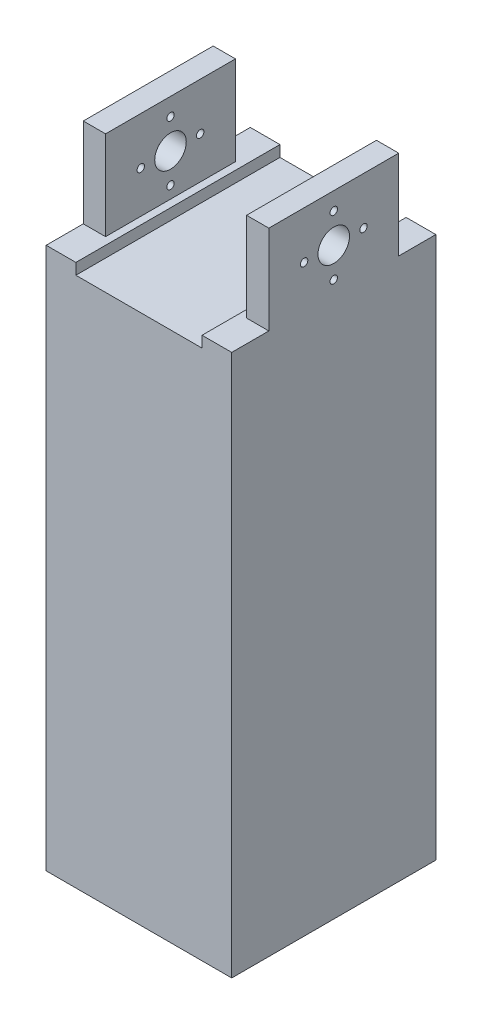
from build123d import *

# Parameters (mm, degrees)
SKETCH1_W           = 50
SKETCH1_H           = 170
BOSS_EXTRUDE1_DEPTH = 55
SKETCH2_W           = 34
SKETCH2_H           = 27
CUT_EXTRUDE1_DEPTH  = 181.416185527
SKETCH3_W           = 10
SKETCH3_H           = 24
SKETCH3_R           = 4.25
SKETCH3_R_2         = 1
CUT_EXTRUDE2_DEPTH  = 186.539753153
SKETCH4_W           = 2
SKETCH4_H           = 24
CUT_EXTRUDE3_DEPTH  = 178.623196683


with BuildPart() as part:
    # Sketch1 → Boss-Extrude1 (new body)
    with BuildSketch(Plane.XY):
        with Locations((0, -85)):
            Rectangle(SKETCH1_W, SKETCH1_H)
    extrude(amount=-BOSS_EXTRUDE1_DEPTH)

    # Sketch2 → Cut-Extrude1 (cut, through all)
    with BuildSketch(Plane.XY):
        with Locations((0, -13.5)):
            Rectangle(SKETCH2_W, SKETCH2_H)
    extrude(amount=-CUT_EXTRUDE1_DEPTH, mode=Mode.SUBTRACT)

    # Sketch3 → Cut-Extrude2 (cut, through all)
    with BuildSketch(Plane(origin=(25, 0, 0), x_dir=(0, 0, -1), z_dir=(1, 0, 0))):
        with Locations((50, -12)):
            Rectangle(SKETCH3_W, SKETCH3_H)
        with Locations((5, -12)):
            Rectangle(SKETCH3_W, SKETCH3_H)
        with Locations((27.5, -12.75)):
            Circle(SKETCH3_R)
        with Locations((35.5, -12.75)):
            Circle(SKETCH3_R_2)
        with Locations((27.5, -4.75)):
            Circle(SKETCH3_R_2)
        with Locations((27.5, -20.75)):
            Circle(SKETCH3_R_2)
        with Locations((19.5, -12.75)):
            Circle(SKETCH3_R_2)
    extrude(amount=-CUT_EXTRUDE2_DEPTH, mode=Mode.SUBTRACT)

    # Sketch4 → Cut-Extrude3 (cut, through all)
    with BuildSketch(Plane.XY.offset(-10)):
        with Locations((-18, -12)):
            Rectangle(SKETCH4_W, SKETCH4_H)
        with Locations((18, -12)):
            Rectangle(SKETCH4_W, SKETCH4_H)
    extrude(amount=-CUT_EXTRUDE3_DEPTH, mode=Mode.SUBTRACT)


solid = part.part
